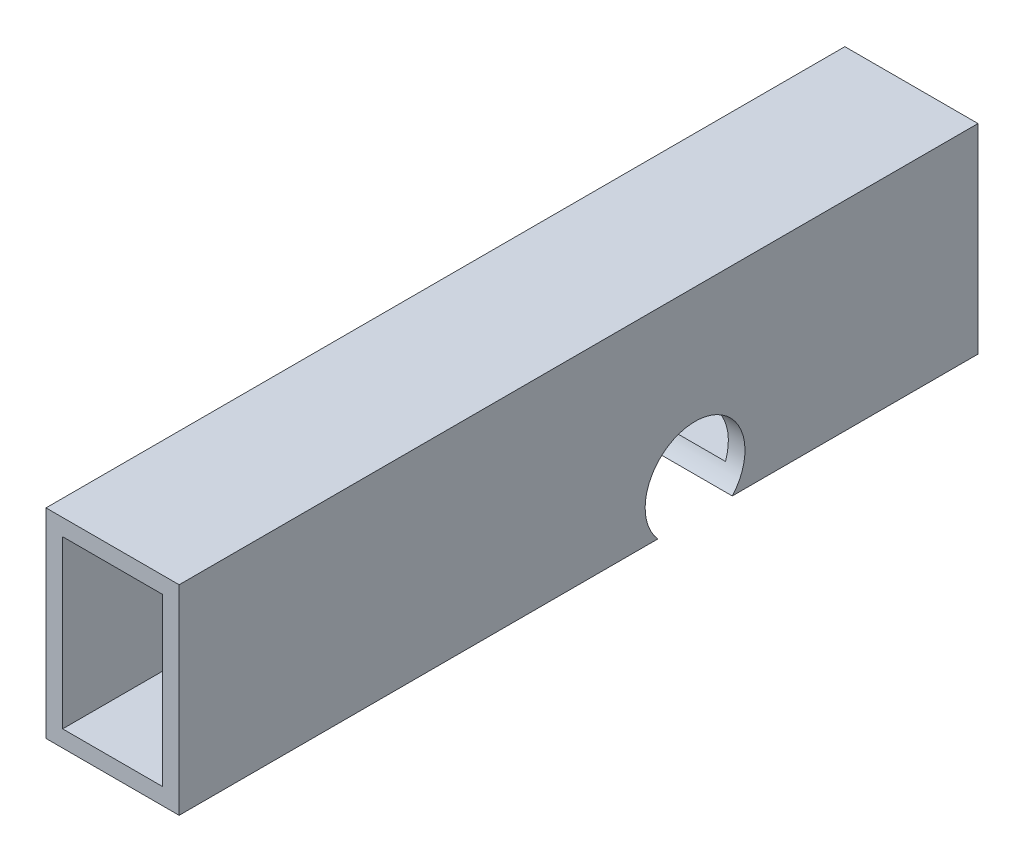
from build123d import *

# Parameters (mm, degrees)
SKETCH1_W           = 25.4
SKETCH1_H           = 38.1
BOSS_EXTRUDE1_DEPTH = 152.4
SHELL1_T            = -3.175
SKETCH2_R           = 9.525
CUT_EXTRUDE1_DEPTH  = 156.672163536


with BuildPart() as part:
    # Sketch1 → Boss-Extrude1 (new body)
    with BuildSketch(Plane.XY):
        Rectangle(SKETCH1_W, SKETCH1_H)
    extrude(amount=BOSS_EXTRUDE1_DEPTH)

    # Shell1
    shell1_openings = [part.faces().sort_by_distance(p)[0] for p in [
        (0, 0, 0),
        (0, 0, 152.4),
    ]]
    offset(amount=SHELL1_T, openings=shell1_openings, kind=Kind.INTERSECTION)

    # Sketch2 → Cut-Extrude1 (cut, through all)
    with BuildSketch(Plane(origin=(12.7, 0, 0), x_dir=(0, 0, -1), z_dir=(1, 0, 0))):
        with Locations((-53.975, -12.7)):
            Circle(SKETCH2_R)
    extrude(amount=-CUT_EXTRUDE1_DEPTH, mode=Mode.SUBTRACT)


solid = part.part
